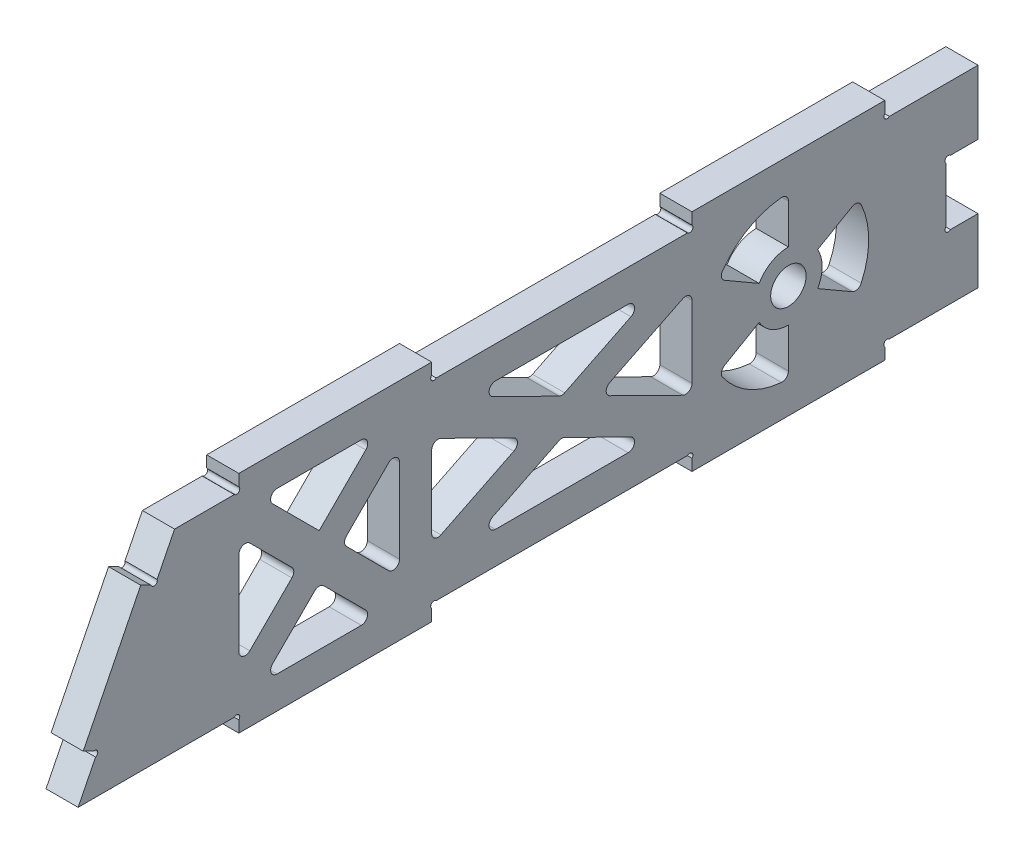
from build123d import *

# Parameters (mm, degrees)
SKETCH1_W               = 355.6
SKETCH1_H               = 76.2
BOSS_EXTRUDE1_DEPTH     = 12.7
CUT_EXTRUDE1_DEPTH      = 183.279291199
CUT_EXTRUDE1_DEPTH_BACK = 183.279291199
SKETCH3_W               = 76.2
SKETCH3_H               = 6.35
BOSS_EXTRUDE2_DEPTH     = 12.7
SKETCH4_W               = 12.7
SKETCH4_H               = 25.4
CUT_EXTRUDE2_DEPTH      = 184.711546997
SKETCH5_R               = 7
CUT_EXTRUDE3_DEPTH      = 184.711546997
CUT_EXTRUDE4_DEPTH      = 184.711546997
BOSS_EXTRUDE3_DEPTH     = 12.7
SKETCH9_R               = 1.27
CUT_EXTRUDE6_DEPTH      = 184.711546997
CUT_EXTRUDE7_DEPTH      = 184.711546997
FILLET1_R               = 2.54
FILLET2_R               = 2.54


with BuildPart() as part:
    # Sketch1 → Boss-Extrude1 (new body)
    with BuildSketch(Plane(origin=(0, 0, 0), x_dir=(0, 0, -1), z_dir=(1, 0, 0))):
        Rectangle(SKETCH1_W, SKETCH1_H)
    extrude(amount=BOSS_EXTRUDE1_DEPTH)

    # Sketch2 → Cut-Extrude1 (cut, two sides: drawn at the far end of the back side and taken through both)
    with BuildSketch(Plane(origin=(12.7, 0, 0), x_dir=(0, 0, -1), z_dir=(1, 0, 0)).offset(-CUT_EXTRUDE1_DEPTH_BACK)):
        Polygon((-507.550847217, -697.601694433), (-177.8, -38.1), (-139.7, 38.1), (190.050847217, 697.601694433), (-1128.95254165, 1357.103388866), (-1826.554236083, -38.1), align=None)
    extrude(amount=CUT_EXTRUDE1_DEPTH + CUT_EXTRUDE1_DEPTH_BACK, mode=Mode.SUBTRACT)

    # Sketch3 → Boss-Extrude2 (add)
    with BuildSketch(Plane.ZY):
        with Locations((-102.87, -41.275)):
            Rectangle(SKETCH3_W, SKETCH3_H)
        with Locations((76.2, -41.275)):
            Rectangle(SKETCH3_W, SKETCH3_H)
        with Locations((-102.87, 41.275)):
            Rectangle(SKETCH3_W, SKETCH3_H)
        with Locations((76.2, 41.275)):
            Rectangle(SKETCH3_W, SKETCH3_H)
    extrude(amount=-BOSS_EXTRUDE2_DEPTH)

    # Sketch4 → Cut-Extrude2 (cut, through all)
    with BuildSketch(Plane.ZY):
        with Locations((-171.45, 0)):
            Rectangle(SKETCH4_W, SKETCH4_H)
    extrude(amount=-CUT_EXTRUDE2_DEPTH, mode=Mode.SUBTRACT)

    # Sketch5 → Cut-Extrude3 (cut, through all)
    with BuildSketch(Plane.ZY):
        with Locations((-102.87, 0)):
            Circle(SKETCH5_R)
    extrude(amount=-CUT_EXTRUDE3_DEPTH, mode=Mode.SUBTRACT)

    # Sketch6 → Cut-Extrude4 (cut, through all)
    with BuildSketch(Plane.ZY):
        Polygon((23.758802297, 25.4), (-50.428802297, 25.4), (-13.335, 7.08207294), align=None)
        Polygon((-27.676197703, 0), (-64.77, 18.31792706), (-64.77, -18.31792706), align=None)
        Polygon((38.1, -18.31792706), (38.1, 18.31792706), (1.006197703, 0), align=None)
        Polygon((-13.335, -7.08207294), (-50.428802297, -25.4), (23.758802297, -25.4), align=None)
        Polygon((105.319743879, 31.75), (59.780256121, 31.75), (82.55, 8.980256121), align=None)
        Polygon((73.569743879, 0), (50.8, 22.769743879), (50.8, -22.769743879), align=None)
        Polygon((114.3, 22.769743879), (91.530256121, 0), (114.3, -22.769743879), align=None)
        Polygon((105.319743879, -31.75), (82.55, -8.980256121), (59.780256121, -31.75), align=None)
    extrude(amount=-CUT_EXTRUDE4_DEPTH, mode=Mode.SUBTRACT)

    # Sketch8 → Boss-Extrude3 (add)
    with BuildSketch(Plane(origin=(12.7, 0, 0), x_dir=(0, 0, -1), z_dir=(1, 0, 0))):
        Polygon((-147.390774674, 22.718450651), (-170.109225326, -22.718450651), (-175.788837989, -19.87864432), (-153.070387337, 25.558256983), align=None)
    extrude(amount=-BOSS_EXTRUDE3_DEPTH)

    # Sketch9 → Cut-Extrude6 (cut, through all)
    with BuildSketch(Plane.ZY):
        with Locations((-165.998025612, 11.801974388)):
            Circle(SKETCH9_R)
        with Locations((-165.998025612, -11.801974388)):
            Circle(SKETCH9_R)
        with Locations((-141.868025612, 38.998025612)):
            Circle(SKETCH9_R)
        with Locations((-141.868025612, -38.998025612)):
            Circle(SKETCH9_R)
        with Locations((-63.871974388, -38.998025612)):
            Circle(SKETCH9_R)
        with Locations((-63.871974388, 38.998025612)):
            Circle(SKETCH9_R)
        with Locations((37.201974388, 38.998025612)):
            Circle(SKETCH9_R)
        with Locations((37.201974388, -38.998025612)):
            Circle(SKETCH9_R)
        with Locations((115.198025612, -38.998025612)):
            Circle(SKETCH9_R)
        with Locations((115.198025612, 38.998025612)):
            Circle(SKETCH9_R)
        with Locations((147.792383937, 23.92327844)):
            Circle(SKETCH9_R)
        with Locations((171.314053114, -23.120059914)):
            Circle(SKETCH9_R)
    extrude(amount=-CUT_EXTRUDE6_DEPTH, mode=Mode.SUBTRACT)

    # Sketch10 → Cut-Extrude7 (cut, through all)
    with BuildSketch(Plane.ZY):
        with BuildLine():
            Line((-130.36630657, -15.875), (-114.431439141, -6.675))
            ThreePointArc((-114.431439141, -6.675), (-116.22, 0), (-114.431439141, 6.675))
            Line((-114.431439141, 6.675), (-130.36630657, 15.875))
            ThreePointArc((-130.36630657, 15.875), (-134.62, 0), (-130.36630657, -15.875))
        make_face()
        with BuildLine():
            ThreePointArc((-91.308560859, -6.675), (-96.195, -11.561439141), (-102.87, -13.35))
            Line((-102.87, -13.35), (-102.87, -31.75))
            ThreePointArc((-102.87, -31.75), (-86.995, -27.49630657), (-75.37369343, -15.875))
            Line((-75.37369343, -15.875), (-91.308560859, -6.675))
        make_face()
        with BuildLine():
            Line((-102.87, 31.75), (-102.87, 13.35))
            ThreePointArc((-102.87, 13.35), (-96.195, 11.561439141), (-91.308560859, 6.675))
            Line((-91.308560859, 6.675), (-75.37369343, 15.875))
            ThreePointArc((-75.37369343, 15.875), (-86.995, 27.49630657), (-102.87, 31.75))
        make_face()
    extrude(amount=-CUT_EXTRUDE7_DEPTH, mode=Mode.SUBTRACT)

    # Fillet1
    fillet1_edges = [part.edges().sort_by_distance(p)[0] for p in [
        (6.35, 15.875, -75.37369343),
        (6.35, 31.75, -102.87),
        (6.35, -31.75, -102.87),
        (6.35, -15.875, -75.37369343),
        (6.35, 15.875, -130.36630657),
        (6.35, -15.875, -130.36630657),
    ]]
    fillet(fillet1_edges, radius=FILLET1_R)

    # Fillet2
    fillet2_edges = [part.edges().sort_by_distance(p)[0] for p in [
        (6.35, 18.31792706, -64.77),
        (6.35, -18.31792706, -64.77),
        (6.35, -25.4, -50.428802297),
        (6.35, -25.4, 23.758802297),
        (6.35, 0, -27.676197703),
        (6.35, 0, 1.006197703),
        (6.35, -7.08207294, -13.335),
        (6.35, 18.31792706, 38.1),
        (6.35, -18.31792706, 38.1),
        (6.35, 7.08207294, -13.335),
        (6.35, 25.4, 23.758802297),
        (6.35, 25.4, -50.428802297),
        (6.35, -31.75, 59.780256121),
        (6.35, -31.75, 105.319743879),
        (6.35, 22.769743879, 50.8),
        (6.35, -22.769743879, 50.8),
        (6.35, -22.769743879, 114.3),
        (6.35, -8.980256121, 82.55),
        (6.35, 22.769743879, 114.3),
        (6.35, 0, 73.569743879),
        (6.35, 31.75, 105.319743879),
        (6.35, 0, 91.530256121),
        (6.35, 31.75, 59.780256121),
    ]]
    fillet(fillet2_edges, radius=FILLET2_R)


solid = part.part
